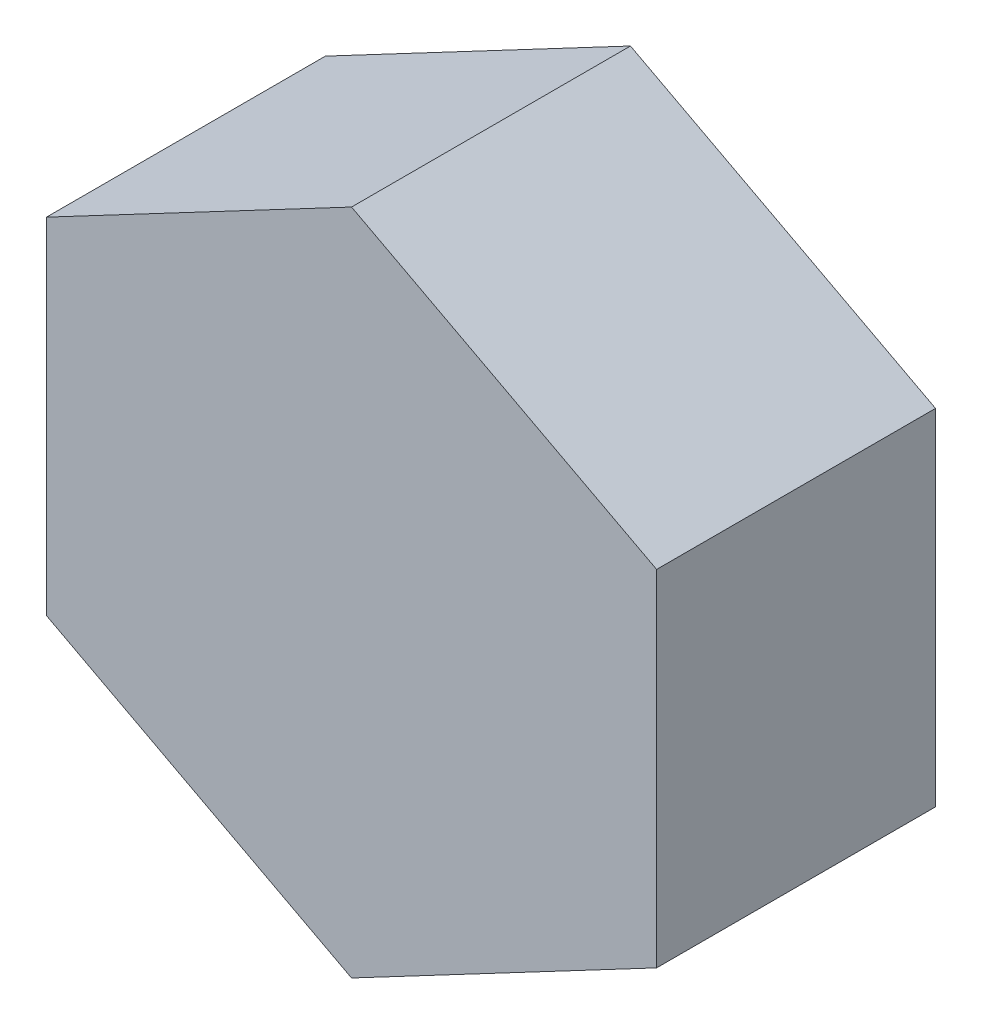
from build123d import *

# Parameters (mm, degrees)
EXTRUDE_1_DEPTH = 3.2


with BuildPart() as part:
    # Эскиз1 → Бобышка-Вытянуть1 (new body)
    with BuildSketch(Plane.XY):
        Polygon((3.5, 1.979534255), (0, 3.83), (-3.5, 1.979534255), (-3.5, -1.979534255), (0, -3.83), (3.5, -1.979534255), align=None)
    extrude(amount=EXTRUDE_1_DEPTH)


solid = part.part
